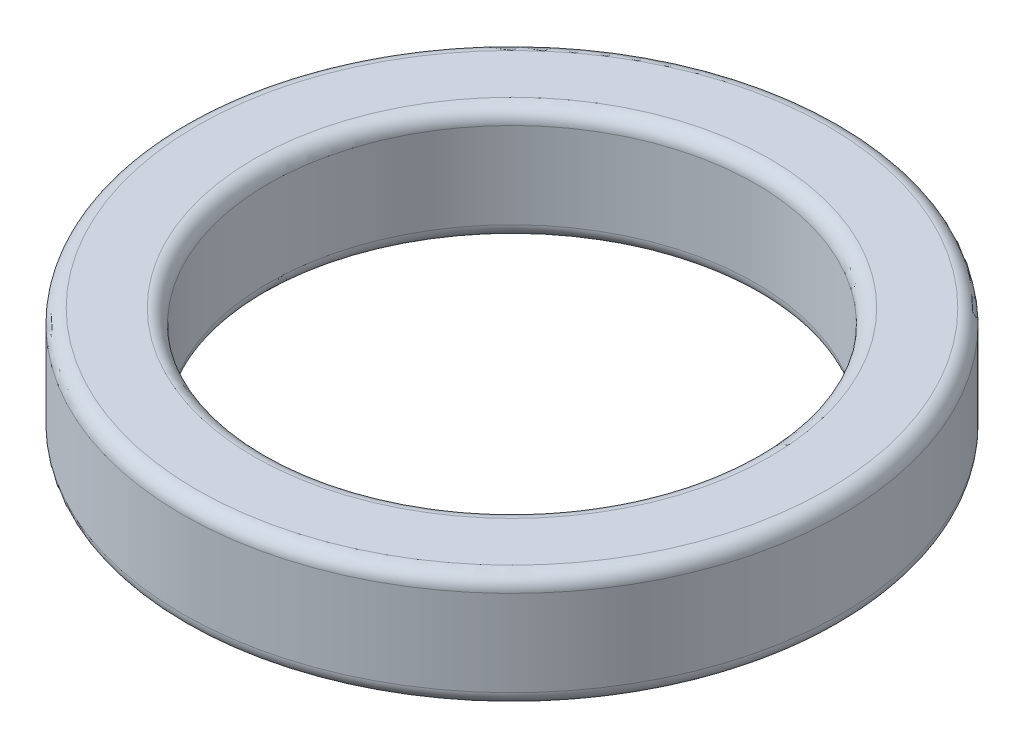
from build123d import *

# Parameters (mm, degrees)
SKIZZE1_R                       = 11.5
SKIZZE1_R_2                     = 8.5
AUFSATZ_LINEAR_AUSTRAGEN1_DEPTH = 4
VERRUNDUNG1_R                   = 0.5


with BuildPart() as part:
    # Skizze1 → Aufsatz-Linear austragen1 (new body)
    with BuildSketch(Plane(origin=(0, 0, 0), x_dir=(1, 0, 0), z_dir=(0, 1, 0))):
        Circle(SKIZZE1_R)
        Circle(SKIZZE1_R_2, mode=Mode.SUBTRACT)
    extrude(amount=AUFSATZ_LINEAR_AUSTRAGEN1_DEPTH)

    # Verrundung1
    verrundung1_edges = [part.edges().sort_by_distance(p)[0] for p in [
        (-11.5, 0, 0),
        (-8.5, 0, 0),
        (-8.5, 4, 0),
        (-11.5, 4, 0),
    ]]
    fillet(verrundung1_edges, radius=VERRUNDUNG1_R)


solid = part.part
